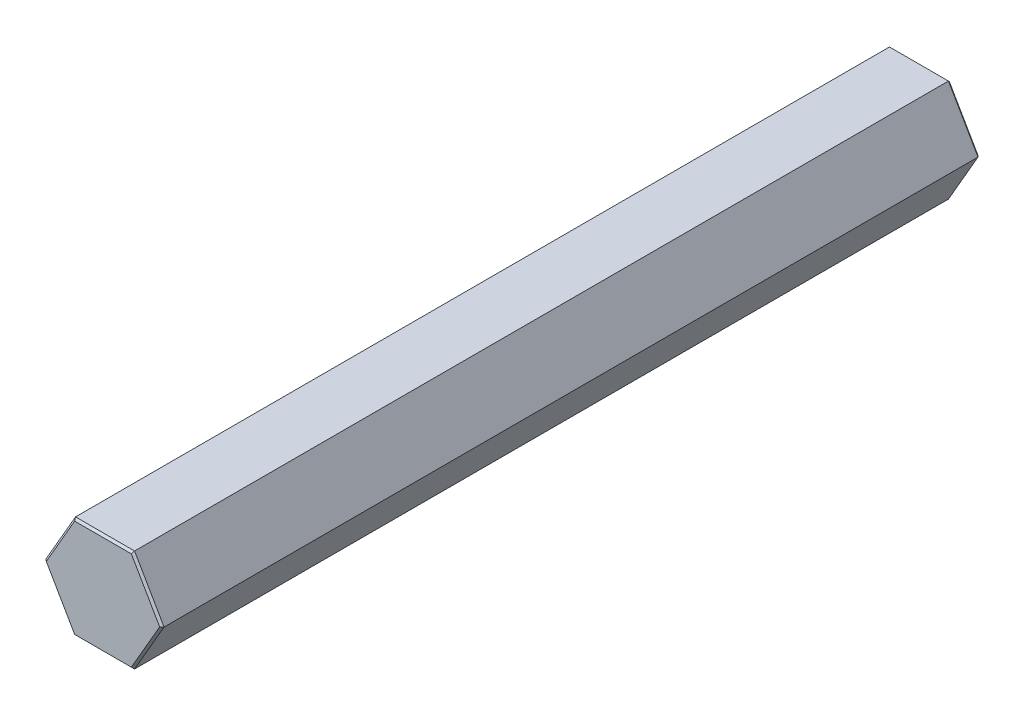
from build123d import *

# Parameters (mm, degrees)
BOSS_EXTRUDE1_DEPTH = 101.6
CHAMFER1_SIZE       = 0.254


with BuildPart() as part:
    # Sketch1 → Boss-Extrude1 (new body)
    with BuildSketch(Plane(origin=(0, 0, 0), x_dir=(-1, 0, 0), z_dir=(0, 0, -1))):
        Polygon((3.666174209, 6.35), (-3.666174209, 6.35), (-7.332348419, 0), (-3.666174209, -6.35), (3.666174209, -6.35), (7.332348419, 0), align=None)
    extrude(amount=-BOSS_EXTRUDE1_DEPTH)

    # Chamfer1
    chamfer1_edges = [part.edges().sort_by_distance(p)[0] for p in [
        (0, -6.35, 0),
        (5.499261314, -3.175, 0),
        (-5.499261314, -3.175, 0),
        (5.499261314, 3.175, 0),
        (-5.499261314, 3.175, 0),
        (0, 6.35, 0),
        (-5.499261314, -3.175, 101.6),
        (0, -6.35, 101.6),
        (-5.499261314, 3.175, 101.6),
        (5.499261314, -3.175, 101.6),
        (0, 6.35, 101.6),
        (5.499261314, 3.175, 101.6),
    ]]
    chamfer(chamfer1_edges, length=CHAMFER1_SIZE)


solid = part.part
